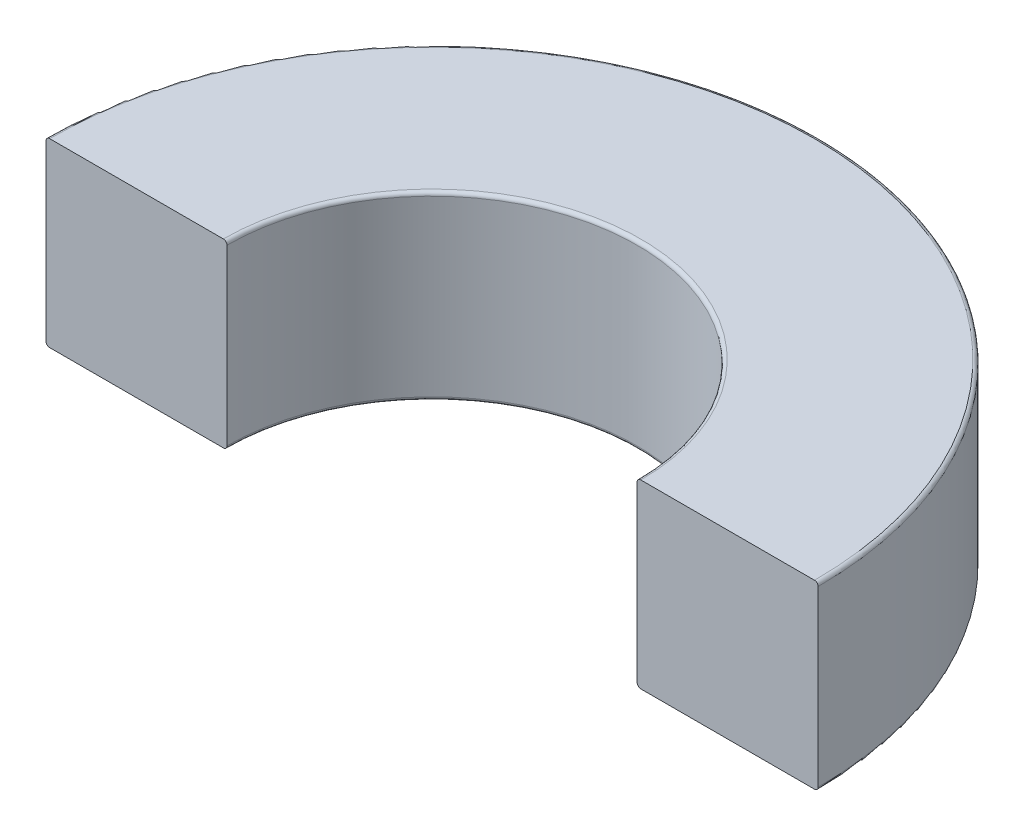
from build123d import *

# Parameters (mm, degrees)
BOSS_EXTRUDE1_DEPTH = 500
FILLET1_R           = 10


with BuildPart() as part:
    # Sketch1 → Boss-Extrude1 (new body)
    with BuildSketch(Plane(origin=(0, 0, 0), x_dir=(1, 0, 0), z_dir=(0, 1, 0))):
        with BuildLine():
            Line((-566.6, 0), (-1066.6, 0))
            ThreePointArc((-1066.6, 0), (0, 1066.6), (1066.6, 0))
            Line((1066.6, 0), (566.6, 0))
            ThreePointArc((566.6, 0), (0, 566.6), (-566.6, 0))
        make_face()
    extrude(amount=BOSS_EXTRUDE1_DEPTH)

    # Fillet1
    fillet1_edges = [part.edges().sort_by_distance(p)[0] for p in [
        (0, 500, -1066.6),
        (0, 0, -1066.6),
        (0, 0, -566.6),
        (0, 500, -566.6),
    ]]
    fillet(fillet1_edges, radius=FILLET1_R)


solid = part.part
